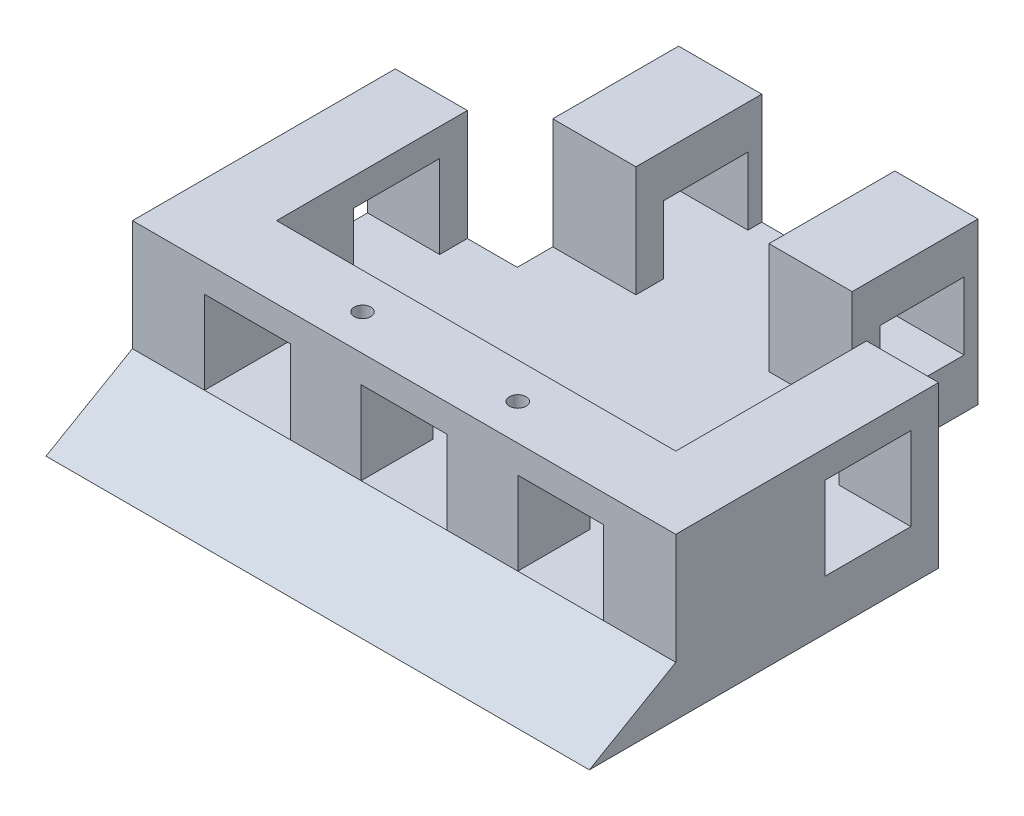
from build123d import *

# Parameters (mm, degrees)
CROQUIS1_W              = 98
CROQUIS1_H              = 98
SALIENTE_EXTRUIR1_DEPTH = 9
CHAFL_N1_SIZE2          = 15.588457268
CHAFL_N1_SIZE           = 9
CROQUIS2_W              = 22
CROQUIS2_H              = 35
CORTAR_EXTRUIR1_DEPTH   = 9
CROQUIS3_W              = 15
CROQUIS3_H              = 2.5
SALIENTE_EXTRUIR2_DEPTH = 12.2
CROQUIS4_W              = 15
CROQUIS4_H              = 20.2
SALIENTE_EXTRUIR3_DEPTH = 2.5
CROQUIS5_W              = 5.9
CROQUIS5_H              = 9
CORTAR_EXTRUIR2_DEPTH   = 54.2
CROQUIS6_W              = 15
CROQUIS6_H              = 14.7
SALIENTE_EXTRUIR4_DEPTH = 2.5
SALIENTE_EXTRUIR5_DEPTH = 20
CROQUIS8_W              = 15.5
CROQUIS8_H              = 15
CORTAR_EXTRUIR3_DEPTH   = 98
CROQUIS9_W              = 15.5
CROQUIS9_H              = 15
CORTAR_EXTRUIR4_DEPTH   = 13
CROQUIS10_W             = 15
CROQUIS10_H             = 22.7
SALIENTE_EXTRUIR6_DEPTH = 5.3
CROQUIS11_R             = 1.5
CORTAR_EXTRUIR5_DEPTH   = 10


with BuildPart() as part:
    # Croquis1 → Saliente-Extruir1 (new body)
    with BuildSketch(Plane(origin=(0, 0, 0), x_dir=(1, 0, 0), z_dir=(0, 1, 0))):
        Rectangle(CROQUIS1_W, CROQUIS1_H)
    extrude(amount=SALIENTE_EXTRUIR1_DEPTH)

    # Chaflán1
    chafl_n1_edges = [part.edges().sort_by_distance(p)[0] for p in [
        (0, 9, 49),
    ]]
    chafl_n1_side = [part.faces().sort_by_distance(p)[0] for p in [
        (0, 8.82, 49),
    ]]
    chamfer(chafl_n1_edges, length=CHAFL_N1_SIZE - 0.0001, length2=CHAFL_N1_SIZE2 - 0.0001, reference=chafl_n1_side[0])  # a hair under: the kernel refuses the full size

    # Croquis2 → Cortar-Extruir1 (cut)
    with BuildSketch(Plane(origin=(0, 9, 0), x_dir=(1, 0, 0), z_dir=(0, 1, 0))):
        with Locations((-38, 31.5)):
            Rectangle(CROQUIS2_W, CROQUIS2_H)
        with Locations((38, 31.5)):
            Rectangle(CROQUIS2_W, CROQUIS2_H)
    extrude(amount=-CORTAR_EXTRUIR1_DEPTH, mode=Mode.SUBTRACT)

    # Croquis3 → Saliente-Extruir2 (add)
    with BuildSketch(Plane(origin=(0, 9, 0), x_dir=(1, 0, 0), z_dir=(0, 1, 0))):
        with Locations((19.5, 41.85)):
            Rectangle(CROQUIS3_W, CROQUIS3_H)
        with Locations((19.5, 24.15)):
            Rectangle(CROQUIS3_W, CROQUIS3_H)
        with Locations((-19.5, 41.85)):
            Rectangle(CROQUIS3_W, CROQUIS3_H)
        with Locations((-19.5, 24.15)):
            Rectangle(CROQUIS3_W, CROQUIS3_H)
    extrude(amount=SALIENTE_EXTRUIR2_DEPTH)

    # Croquis4 → Saliente-Extruir3 (add)
    with BuildSketch(Plane(origin=(0, 21.2, 0), x_dir=(1, 0, 0), z_dir=(0, 1, 0))):
        with Locations((-19.5, 33)):
            Rectangle(CROQUIS4_W, CROQUIS4_H)
        with Locations((19.5, 33)):
            Rectangle(CROQUIS4_W, CROQUIS4_H)
    extrude(amount=SALIENTE_EXTRUIR3_DEPTH)

    # Croquis5 → Cortar-Extruir2 (cut)
    with BuildSketch(Plane(origin=(27, 0, 0), x_dir=(0, 0, -1), z_dir=(1, 0, 0))):
        with Locations((46.05, 4.5)):
            Rectangle(CROQUIS5_W, CROQUIS5_H)
    extrude(amount=-CORTAR_EXTRUIR2_DEPTH, mode=Mode.SUBTRACT)

    # Croquis6 → Saliente-Extruir4 (add)
    with BuildSketch(Plane.XY.offset(-22.9)):
        with Locations((-19.5, 16.35)):
            Rectangle(CROQUIS6_W, CROQUIS6_H)
        with Locations((19.5, 16.35)):
            Rectangle(CROQUIS6_W, CROQUIS6_H)
    extrude(amount=SALIENTE_EXTRUIR4_DEPTH)

    # Croquis7 → Saliente-Extruir5 (add)
    with BuildSketch(Plane(origin=(0, 9, 0), x_dir=(1, 0, 0), z_dir=(0, 1, 0))):
        Polygon((-49, 14), (-49, -33.411542732), (49, -33.411542732), (49, 14), (36, 14), (36, -20.411542732), (-36, -20.411542732), (-36, 14), align=None)
    extrude(amount=SALIENTE_EXTRUIR5_DEPTH)

    # Croquis8 → Cortar-Extruir3 (cut)
    with BuildSketch(Plane(origin=(49, 0, 0), x_dir=(0, 0, -1), z_dir=(1, 0, 0))):
        with Locations((1.25, 16.5)):
            Rectangle(CROQUIS8_W, CROQUIS8_H)
    extrude(amount=-CORTAR_EXTRUIR3_DEPTH, mode=Mode.SUBTRACT)

    # Croquis9 → Cortar-Extruir4 (cut)
    with BuildSketch(Plane.XY.offset(33.411542732)):
        with Locations((-28.25, 16.5)):
            Rectangle(CROQUIS9_W, CROQUIS9_H)
        with Locations((0, 16.5)):
            Rectangle(CROQUIS9_W, CROQUIS9_H)
        with Locations((28.25, 16.5)):
            Rectangle(CROQUIS9_W, CROQUIS9_H)
    extrude(amount=-CORTAR_EXTRUIR4_DEPTH, mode=Mode.SUBTRACT)

    # Croquis10 → Saliente-Extruir6 (add)
    with BuildSketch(Plane(origin=(0, 23.7, 0), x_dir=(1, 0, 0), z_dir=(0, 1, 0))):
        with Locations((-19.5, 31.75)):
            Rectangle(CROQUIS10_W, CROQUIS10_H)
        with Locations((19.5, 31.75)):
            Rectangle(CROQUIS10_W, CROQUIS10_H)
    extrude(amount=SALIENTE_EXTRUIR6_DEPTH)

    # Croquis11 → Cortar-Extruir5 (cut)
    with BuildSketch(Plane(origin=(0, 29, 0), x_dir=(1, 0, 0), z_dir=(0, 1, 0))):
        with Locations(Location((-14, -26.911542732, 0), (0, 0, 270))):
            Circle(CROQUIS11_R)
        with Locations(Location((14, -26.911542732, 0), (0, 0, 270))):
            Circle(CROQUIS11_R)
    extrude(amount=-CORTAR_EXTRUIR5_DEPTH, mode=Mode.SUBTRACT)


solid = part.part
